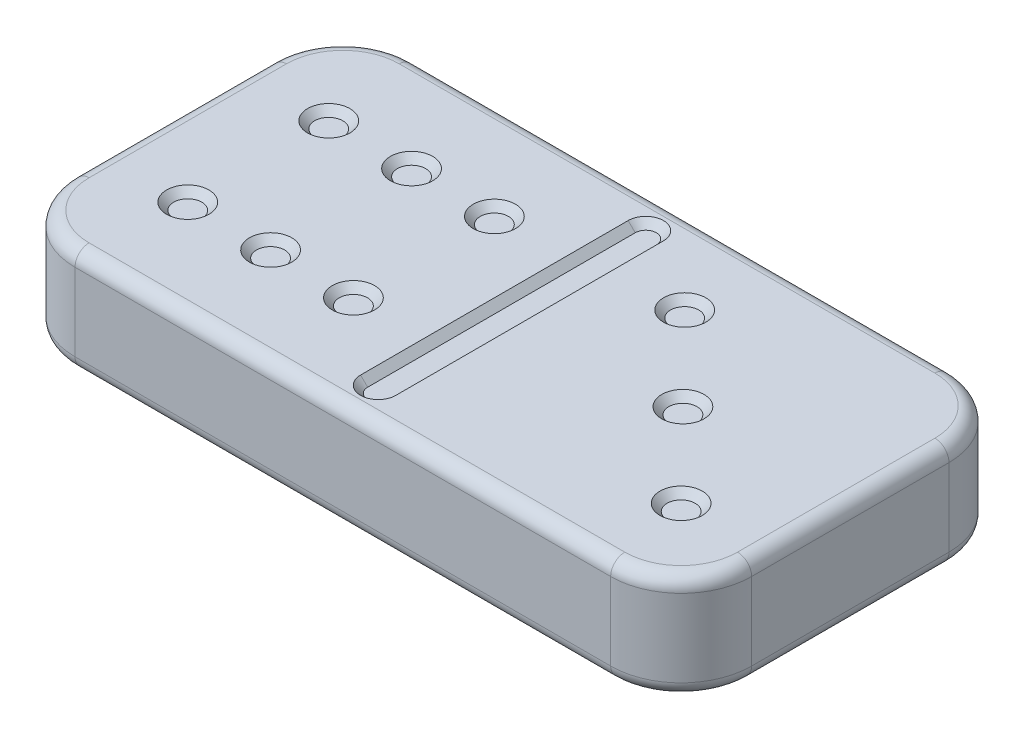
from build123d import *

# Parameters (mm, degrees)
ESQUISSE1_W                = 48
ESQUISSE1_H                = 24
EXTRUSION1_DEPTH           = 7.5
CONG_2_R                   = 5
CONG_5_R                   = 1
CONG_6_R                   = 1
ESQUISSE4_W                = 0.5
ESQUISSE4_H                = 18.982849842
EXTRUSION2_DEPTH           = 0.5
ESQUISSE5_R                = 0.25
EXTRUSION3_DEPTH           = 0.5
CHANFREIN1_SIZE            = 1
ESQUISSE6_R                = 1.5
EXTRUSION6_DEPTH           = 0.5
EXTRUSION6_DRAFT           = -45
EXTRUSION6_PROFILE_2_DEPTH = 0.5
EXTRUSION6_PROFILE_2_DRAFT = -45
EXTRUSION6_PROFILE_3_DEPTH = 0.5
EXTRUSION6_PROFILE_3_DRAFT = -45
EXTRUSION6_PROFILE_4_DEPTH = 0.5
EXTRUSION6_PROFILE_4_DRAFT = -45
EXTRUSION6_PROFILE_5_DEPTH = 0.5
EXTRUSION6_PROFILE_5_DRAFT = -45
EXTRUSION6_PROFILE_6_DEPTH = 0.5
EXTRUSION6_PROFILE_6_DRAFT = -45
EXTRUSION6_PROFILE_7_DEPTH = 0.5
EXTRUSION6_PROFILE_7_DRAFT = -45
EXTRUSION6_PROFILE_8_DEPTH = 0.5
EXTRUSION6_PROFILE_8_DRAFT = -45
EXTRUSION6_PROFILE_9_DEPTH = 0.5
EXTRUSION6_PROFILE_9_DRAFT = -45


with BuildPart() as part:
    # Esquisse1 → Extrusion1 (new body)
    with BuildSketch(Plane(origin=(0, 0, 0), x_dir=(1, 0, 0), z_dir=(0, 1, 0))):
        with Locations((24, 12)):
            Rectangle(ESQUISSE1_W, ESQUISSE1_H)
    extrude(amount=EXTRUSION1_DEPTH)

    # Congé2
    cong_2_edges = [part.edges().sort_by_distance(p)[0] for p in [
        (0, 3.75, -24),
        (48, 3.75, -24),
        (48, 3.75, 0),
        (0, 3.75, 0),
    ]]
    fillet(cong_2_edges, radius=CONG_2_R)

    # Congé5
    cong_5_edges = [part.edges().sort_by_distance(p)[0] for p in [
        (48, 7.5, -12),
        (24, 7.5, 0),
        (0, 7.5, -12),
        (24, 7.5, -24),
        (1.464466094, 7.5, -22.535533906),
        (1.464466094, 7.5, -1.464466094),
        (46.535533906, 7.5, -22.535533906),
        (46.535533906, 7.5, -1.464466094),
    ]]
    fillet(cong_5_edges, radius=CONG_5_R)

    # Congé6
    cong_6_edges = [part.edges().sort_by_distance(p)[0] for p in [
        (48, 0, -12),
        (0, 0, -12),
        (24, 0, -24),
        (24, 0, 0),
        (1.464466094, 0, -22.535533906),
        (1.464466094, 0, -1.464466094),
        (46.535533906, 0, -22.535533906),
        (46.535533906, 0, -1.464466094),
    ]]
    fillet(cong_6_edges, radius=CONG_6_R)

    # Esquisse4 → Extrusion2 (cut)
    with BuildSketch(Plane(origin=(0, 7.5, 0), x_dir=(1, 0, 0), z_dir=(0, 1, 0))):
        with Locations((24, 12)):
            Rectangle(ESQUISSE4_W, ESQUISSE4_H)
    extrude(amount=-EXTRUSION2_DEPTH, mode=Mode.SUBTRACT)

    # Esquisse5 → Extrusion3 (cut)
    with BuildSketch(Plane(origin=(0, 7.5, 0), x_dir=(1, 0, 0), z_dir=(0, 1, 0))):
        with Locations((24, 21.491424921)):
            Circle(ESQUISSE5_R)
        with Locations((24, 2.508575079)):
            Circle(ESQUISSE5_R)
    extrude(amount=-EXTRUSION3_DEPTH, mode=Mode.SUBTRACT)

    # Chanfrein1
    # the kernel refuses this chamfer: 1 mm, written as the material it takes off along each edge
    with BuildSketch(Plane(origin=(24, 7.5, -21.491424921), x_dir=(1, 0, 0), z_dir=(0, 0, 1))) as chanfrein1_piece_1_section:
        Polygon((0.25 + CHANFREIN1_SIZE, 0), (0.25, -CHANFREIN1_SIZE), (0.25, 0), align=None)
    chanfrein1_piece_1 = revolve(axis=Axis((24, 7.5, -21.491424921), (0, 1, 0)), revolution_arc=180, mode=Mode.PRIVATE)
    chanfrein1_piece_1 = split(chanfrein1_piece_1, bisect_by=Plane(origin=(24, 7, -21.964580549), z_dir=(0, 1, 0)), keep=Keep.TOP, mode=Mode.PRIVATE)
    add(chanfrein1_piece_1, mode=Mode.SUBTRACT)
    with BuildSketch(Plane(origin=(24.25, 7.5, -21.491424921), x_dir=(0.9996219169112968, 0.02749587661058651, 0), z_dir=(0, 0, 1))) as chanfrein1_piece_2_section:
        Polygon((CHANFREIN1_SIZE * 0.999621916911, -CHANFREIN1_SIZE * 0.0274958766106), (-CHANFREIN1_SIZE * 0.0274958766106, -CHANFREIN1_SIZE * 0.999621916911), (0, 0), align=None)
    chanfrein1_piece_2 = extrude(amount=18.982849842, mode=Mode.PRIVATE)
    chanfrein1_piece_2 = split(chanfrein1_piece_2, bisect_by=Plane(origin=(24.643401084, 7, -12), z_dir=(0, 1, 0)), keep=Keep.TOP, mode=Mode.PRIVATE)
    add(chanfrein1_piece_2, mode=Mode.SUBTRACT)
    with BuildSketch(Plane(origin=(24, 7.5, -2.508575079), x_dir=(-1, 0, 0), z_dir=(0, 0, -1))) as chanfrein1_piece_3_section:
        Polygon((0.25 + CHANFREIN1_SIZE, 0), (0.25, -CHANFREIN1_SIZE), (0.25, 0), align=None)
    chanfrein1_piece_3 = revolve(axis=Axis((24, 7.5, -2.508575079), (0, 1, 0)), revolution_arc=180, mode=Mode.PRIVATE)
    chanfrein1_piece_3 = split(chanfrein1_piece_3, bisect_by=Plane(origin=(24, 7, -2.035419451), z_dir=(0, 1, 0)), keep=Keep.TOP, mode=Mode.PRIVATE)
    add(chanfrein1_piece_3, mode=Mode.SUBTRACT)
    with BuildSketch(Plane(origin=(23.75, 7.5, -2.508575079), x_dir=(-0.9996219169112968, 0.02749587661058651, 0), z_dir=(0, 0, -1))) as chanfrein1_piece_4_section:
        Polygon((CHANFREIN1_SIZE * 0.999621916911, -CHANFREIN1_SIZE * 0.0274958766106), (-CHANFREIN1_SIZE * 0.0274958766106, -CHANFREIN1_SIZE * 0.999621916911), (0, 0), align=None)
    chanfrein1_piece_4 = extrude(amount=18.982849842, mode=Mode.PRIVATE)
    chanfrein1_piece_4 = split(chanfrein1_piece_4, bisect_by=Plane(origin=(23.356598916, 7, -12), z_dir=(0, 1, 0)), keep=Keep.TOP, mode=Mode.PRIVATE)
    add(chanfrein1_piece_4, mode=Mode.SUBTRACT)


with BuildPart() as extrusion6_tool:
    # Esquisse6 → Extrusion6 (with draft: the straight prism first)
    with BuildSketch(Plane(origin=(0, 7.5, 0), x_dir=(1, 0, 0), z_dir=(0, 1, 0))):
        with Locations((42, 6)):
            Circle(ESQUISSE6_R)
    extrude(amount=-EXTRUSION6_DEPTH)
    # Extrusion6: the draft: its side faces are tilted about the plane it starts from
    extrusion6_sides = [extrusion6_tool.faces().sort_by_distance(p)[0] for p in [
        (40.5, 7.25, -6),
    ]]
    draft(extrusion6_sides, Plane(origin=(0, 7.5, 0), x_dir=(1, 0, 0), z_dir=(0, 1, 0)), EXTRUSION6_DRAFT)


with BuildPart() as part_1:
    add(part.part)

    # Extrusion6: cut by extrusion6_tool
    add(extrusion6_tool.part, mode=Mode.SUBTRACT)


with BuildPart() as extrusion6_profile_2_tool:
    # Esquisse6 → Extrusion6 profile 2 (with draft: the straight prism first)
    with BuildSketch(Plane(origin=(0, 7.5, 0), x_dir=(1, 0, 0), z_dir=(0, 1, 0))):
        with Locations((30.25, 18)):
            Circle(ESQUISSE6_R)
    extrude(amount=-EXTRUSION6_PROFILE_2_DEPTH)
    # Extrusion6 profile 2: the draft: its side faces are tilted about the plane it starts from
    extrusion6_profile_2_sides = [extrusion6_profile_2_tool.faces().sort_by_distance(p)[0] for p in [
        (28.75, 7.25, -18),
    ]]
    draft(extrusion6_profile_2_sides, Plane(origin=(0, 7.5, 0), x_dir=(1, 0, 0), z_dir=(0, 1, 0)), EXTRUSION6_PROFILE_2_DRAFT)


with BuildPart() as part_2:
    add(part_1.part)

    # Extrusion6 profile 2: cut by extrusion6_profile_2_tool
    add(extrusion6_profile_2_tool.part, mode=Mode.SUBTRACT)


with BuildPart() as extrusion6_profile_3_tool:
    # Esquisse6 → Extrusion6 profile 3 (with draft: the straight prism first)
    with BuildSketch(Plane(origin=(0, 7.5, 0), x_dir=(1, 0, 0), z_dir=(0, 1, 0))):
        with Locations((11.875, 17)):
            Circle(ESQUISSE6_R)
    extrude(amount=-EXTRUSION6_PROFILE_3_DEPTH)
    # Extrusion6 profile 3: the draft: its side faces are tilted about the plane it starts from
    extrusion6_profile_3_sides = [extrusion6_profile_3_tool.faces().sort_by_distance(p)[0] for p in [
        (10.375, 7.25, -17),
    ]]
    draft(extrusion6_profile_3_sides, Plane(origin=(0, 7.5, 0), x_dir=(1, 0, 0), z_dir=(0, 1, 0)), EXTRUSION6_PROFILE_3_DRAFT)


with BuildPart() as part_3:
    add(part_2.part)

    # Extrusion6 profile 3: cut by extrusion6_profile_3_tool
    add(extrusion6_profile_3_tool.part, mode=Mode.SUBTRACT)


with BuildPart() as extrusion6_profile_4_tool:
    # Esquisse6 → Extrusion6 profile 4 (with draft: the straight prism first)
    with BuildSketch(Plane(origin=(0, 7.5, 0), x_dir=(1, 0, 0), z_dir=(0, 1, 0))):
        with Locations((17.75, 17)):
            Circle(ESQUISSE6_R)
    extrude(amount=-EXTRUSION6_PROFILE_4_DEPTH)
    # Extrusion6 profile 4: the draft: its side faces are tilted about the plane it starts from
    extrusion6_profile_4_sides = [extrusion6_profile_4_tool.faces().sort_by_distance(p)[0] for p in [
        (16.25, 7.25, -17),
    ]]
    draft(extrusion6_profile_4_sides, Plane(origin=(0, 7.5, 0), x_dir=(1, 0, 0), z_dir=(0, 1, 0)), EXTRUSION6_PROFILE_4_DRAFT)


with BuildPart() as part_4:
    add(part_3.part)

    # Extrusion6 profile 4: cut by extrusion6_profile_4_tool
    add(extrusion6_profile_4_tool.part, mode=Mode.SUBTRACT)


with BuildPart() as extrusion6_profile_5_tool:
    # Esquisse6 → Extrusion6 profile 5 (with draft: the straight prism first)
    with BuildSketch(Plane(origin=(0, 7.5, 0), x_dir=(1, 0, 0), z_dir=(0, 1, 0))):
        with Locations((6, 17)):
            Circle(ESQUISSE6_R)
    extrude(amount=-EXTRUSION6_PROFILE_5_DEPTH)
    # Extrusion6 profile 5: the draft: its side faces are tilted about the plane it starts from
    extrusion6_profile_5_sides = [extrusion6_profile_5_tool.faces().sort_by_distance(p)[0] for p in [
        (4.5, 7.25, -17),
    ]]
    draft(extrusion6_profile_5_sides, Plane(origin=(0, 7.5, 0), x_dir=(1, 0, 0), z_dir=(0, 1, 0)), EXTRUSION6_PROFILE_5_DRAFT)


with BuildPart() as part_5:
    add(part_4.part)

    # Extrusion6 profile 5: cut by extrusion6_profile_5_tool
    add(extrusion6_profile_5_tool.part, mode=Mode.SUBTRACT)


with BuildPart() as extrusion6_profile_6_tool:
    # Esquisse6 → Extrusion6 profile 6 (with draft: the straight prism first)
    with BuildSketch(Plane(origin=(0, 7.5, 0), x_dir=(1, 0, 0), z_dir=(0, 1, 0))):
        with Locations((11.875, 7)):
            Circle(ESQUISSE6_R)
    extrude(amount=-EXTRUSION6_PROFILE_6_DEPTH)
    # Extrusion6 profile 6: the draft: its side faces are tilted about the plane it starts from
    extrusion6_profile_6_sides = [extrusion6_profile_6_tool.faces().sort_by_distance(p)[0] for p in [
        (10.375, 7.25, -7),
    ]]
    draft(extrusion6_profile_6_sides, Plane(origin=(0, 7.5, 0), x_dir=(1, 0, 0), z_dir=(0, 1, 0)), EXTRUSION6_PROFILE_6_DRAFT)


with BuildPart() as part_6:
    add(part_5.part)

    # Extrusion6 profile 6: cut by extrusion6_profile_6_tool
    add(extrusion6_profile_6_tool.part, mode=Mode.SUBTRACT)


with BuildPart() as extrusion6_profile_7_tool:
    # Esquisse6 → Extrusion6 profile 7 (with draft: the straight prism first)
    with BuildSketch(Plane(origin=(0, 7.5, 0), x_dir=(1, 0, 0), z_dir=(0, 1, 0))):
        with Locations((6, 7)):
            Circle(ESQUISSE6_R)
    extrude(amount=-EXTRUSION6_PROFILE_7_DEPTH)
    # Extrusion6 profile 7: the draft: its side faces are tilted about the plane it starts from
    extrusion6_profile_7_sides = [extrusion6_profile_7_tool.faces().sort_by_distance(p)[0] for p in [
        (4.5, 7.25, -7),
    ]]
    draft(extrusion6_profile_7_sides, Plane(origin=(0, 7.5, 0), x_dir=(1, 0, 0), z_dir=(0, 1, 0)), EXTRUSION6_PROFILE_7_DRAFT)


with BuildPart() as part_7:
    add(part_6.part)

    # Extrusion6 profile 7: cut by extrusion6_profile_7_tool
    add(extrusion6_profile_7_tool.part, mode=Mode.SUBTRACT)


with BuildPart() as extrusion6_profile_8_tool:
    # Esquisse6 → Extrusion6 profile 8 (with draft: the straight prism first)
    with BuildSketch(Plane(origin=(0, 7.5, 0), x_dir=(1, 0, 0), z_dir=(0, 1, 0))):
        with Locations((17.75, 7)):
            Circle(ESQUISSE6_R)
    extrude(amount=-EXTRUSION6_PROFILE_8_DEPTH)
    # Extrusion6 profile 8: the draft: its side faces are tilted about the plane it starts from
    extrusion6_profile_8_sides = [extrusion6_profile_8_tool.faces().sort_by_distance(p)[0] for p in [
        (16.25, 7.25, -7),
    ]]
    draft(extrusion6_profile_8_sides, Plane(origin=(0, 7.5, 0), x_dir=(1, 0, 0), z_dir=(0, 1, 0)), EXTRUSION6_PROFILE_8_DRAFT)


with BuildPart() as part_8:
    add(part_7.part)

    # Extrusion6 profile 8: cut by extrusion6_profile_8_tool
    add(extrusion6_profile_8_tool.part, mode=Mode.SUBTRACT)


with BuildPart() as extrusion6_profile_9_tool:
    # Esquisse6 → Extrusion6 profile 9 (with draft: the straight prism first)
    with BuildSketch(Plane(origin=(0, 7.5, 0), x_dir=(1, 0, 0), z_dir=(0, 1, 0))):
        with Locations((36.125, 12)):
            Circle(ESQUISSE6_R)
    extrude(amount=-EXTRUSION6_PROFILE_9_DEPTH)
    # Extrusion6 profile 9: the draft: its side faces are tilted about the plane it starts from
    extrusion6_profile_9_sides = [extrusion6_profile_9_tool.faces().sort_by_distance(p)[0] for p in [
        (34.625, 7.25, -12),
    ]]
    draft(extrusion6_profile_9_sides, Plane(origin=(0, 7.5, 0), x_dir=(1, 0, 0), z_dir=(0, 1, 0)), EXTRUSION6_PROFILE_9_DRAFT)


with BuildPart() as part_9:
    add(part_8.part)

    # Extrusion6 profile 9: cut by extrusion6_profile_9_tool
    add(extrusion6_profile_9_tool.part, mode=Mode.SUBTRACT)


solid = part_9.part
